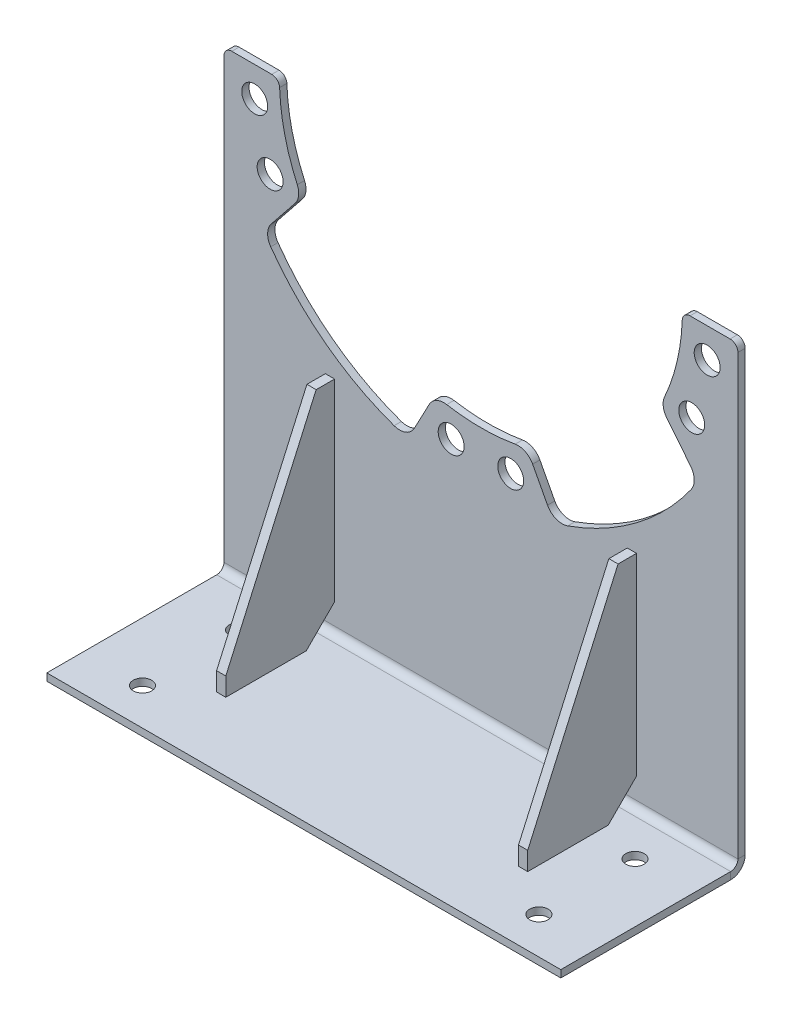
from build123d import *

# Parameters (mm, degrees)
SKETCH1_R                    = 355.6
BOSS_EXTRUDE1_DEPTH          = 60.325
SKETCH2_R                    = 17.4625
BOLTHOLE_DEPTH               = 507.499581071
BOLTHOLEPATTERN_COUNT        = 24
SKETCH5_OUTSIDE_W            = 914.72
SKETCH5_OUTSIDE_H            = 914.72
SKETCH5_OUTSIDE_R            = 266.7
RAISED_FACE_DEPTH            = 1.5875
FILLET2_R                    = 1.5875
FILLET3_R                    = 1.5875
SKETCH11_R                   = 230.886
CUT_EXTRUDE5_DEPTH           = 507.499581211
SKETCH12_R                   = 17.867836571
BOSS_EXTRUDE2_DEPTH          = 5.08
CONVERT_SOLID1_OUTLINE_R     = 355.6
CONVERT_SOLID1_OUTLINE_R_2   = 17.4625
CONVERT_SOLID1_OUTLINE_R_3   = 230.886
CONVERT_SOLID1_DEPTH         = 55.405
CONVERT_SOLID1_START         = 55.405
CONVERT_SOLID1_2_OUTLINE_R   = 17.4625
CONVERT_SOLID1_2_OUTLINE_R_2 = 230.886
CONVERT_SOLID1_2_OUTLINE_R_3 = 17.867836571
CONVERT_SOLID1_2_DEPTH       = 4.92
CONVERT_SOLID1_3_OUTLINE_R   = 17.867836571
CONVERT_SOLID1_3_DEPTH       = 4.92
EDGE_FLANGE1_STRIP_W         = 60
EDGE_FLANGE1_STRIP_H         = 10
EDGE_FLANGE1_STRIP_CUT_DEPTH = 708.025
EDGE_FLANGE1_DEPTH           = 708.025
SKETCH21_R                   = 12.7
CUT_EXTRUDE6_DEPTH           = 791.114741274
SKETCH22_W                   = 12.7
SKETCH22_H                   = 304.8
BOSS_EXTRUDE3_DEPTH          = 149.86
CUT_EXTRUDE12_DEPTH          = 907.614449346


# Read off the part's stored shape, not the designer's step: Convert-Solid1
# Sheet-metal steps are written as plain solids
with BuildPart() as part:
    # Sketch1 → Boss-Extrude1 (new body)
    with BuildSketch(Plane.XY):
        with Locations(Location((0, 0, 0), (0, 0, 180))):
            Circle(SKETCH1_R)
    extrude(amount=BOSS_EXTRUDE1_DEPTH)

    # Sketch2 → BoltHole (cut, through all)
    with BuildSketch(Plane.XY):
        with Locations(Location((41.02764537, 311.635906051, 0), (0, 0, 180))):
            Circle(SKETCH2_R)
    bolthole = extrude(amount=BOLTHOLE_DEPTH, mode=Mode.SUBTRACT)

    # BoltHolePattern: BoltHole ×24 about axis
    boltholepattern_axis = Axis((0, 0, 0), (0, 0, 1))
    for i in range(1, BOLTHOLEPATTERN_COUNT):
        add(bolthole.rotate(boltholepattern_axis, i * 360 / BOLTHOLEPATTERN_COUNT), mode=Mode.SUBTRACT)

    # Sketch5 outside → Raised Face (cut)
    with BuildSketch(Plane(origin=(0, 0, 0), x_dir=(-1, 0, 0), z_dir=(0, 0, -1))):
        Rectangle(SKETCH5_OUTSIDE_W, SKETCH5_OUTSIDE_H)
        Circle(SKETCH5_OUTSIDE_R, mode=Mode.SUBTRACT)
    extrude(amount=-RAISED_FACE_DEPTH, mode=Mode.SUBTRACT)

    # Fillet2
    fillet2_edges = [part.edges().sort_by_distance(p)[0] for p in [
        (355.6, 0, 1.5875),
        (355.6, 0, 60.325),
    ]]
    fillet(fillet2_edges, radius=FILLET2_R)

    # Fillet3
    fillet3_edges = [part.edges().sort_by_distance(p)[0] for p in [
        (266.7, 0, 1.5875),
    ]]
    fillet(fillet3_edges, radius=FILLET3_R - 0.0001)  # a hair under: the kernel refuses the full size

    # Sketch11 → Cut-Extrude5 (cut, through all)
    with BuildSketch(Plane.XY):
        with Locations(Location((0, 0, 0), (0, 0, 180))):
            Circle(SKETCH11_R)
    extrude(amount=CUT_EXTRUDE5_DEPTH, mode=Mode.SUBTRACT)

    # Sketch12 → Boss-Extrude2 (add)
    with BuildSketch(Plane.XY.offset(60.325)):
        with BuildLine():
            Line((-343.2175, 0), (-288.130046772, 0))
            ThreePointArc((-288.130046772, 0), (-280.641083905, -3.020203528), (-277.342615169, -10.390841095))
            ThreePointArc((-277.342615169, -10.390841095), (-270.190767513, -63.433783731), (-252.99027113, -114.117564297))
            ThreePointArc((-252.99027113, -114.117564297), (-251.148770275, -126.38308213), (-255.983573502, -137.804935346))
            Line((-255.983573502, -137.804935346), (-288.819243573, -178.81520867))
            ThreePointArc((-288.819243573, -178.81520867), (-293.825450252, -192.463019981), (-289.590973462, -206.369639456))
            ThreePointArc((-289.590973462, -206.369639456), (-214.456918936, -283.653996835), (-119.619161223, -334.877016632))
            ThreePointArc((-119.619161223, -334.877016632), (-103.646930374, -334.656038137), (-91.71877708, -324.031531146))
            Line((-91.71877708, -324.031531146), (-71.270266052, -285.343663587))
            ThreePointArc((-71.270266052, -285.343663587), (-61.144446621, -275.510694804), (-47.174081625, -273.498632154))
            ThreePointArc((-47.174081625, -273.498632154), (0, -277.537197088), (47.174081625, -273.498632154))
            ThreePointArc((47.174081625, -273.498632154), (61.144446621, -275.510694804), (71.270266052, -285.343663587))
            Line((71.270266052, -285.343663587), (91.71877708, -324.031531146))
            ThreePointArc((91.71877708, -324.031531146), (103.646930374, -334.656038137), (119.619161223, -334.877016632))
            ThreePointArc((119.619161223, -334.877016632), (214.456918936, -283.653996835), (289.590973462, -206.369639456))
            ThreePointArc((289.590973462, -206.369639456), (293.825450252, -192.463019981), (288.819243573, -178.81520867))
            Line((288.819243573, -178.81520867), (255.983573502, -137.804935346))
            ThreePointArc((255.983573502, -137.804935346), (251.148770275, -126.38308213), (252.99027113, -114.117564297))
            ThreePointArc((252.99027113, -114.117564297), (270.190767513, -63.433783731), (277.342615169, -10.390841095))
            ThreePointArc((277.342615169, -10.390841095), (280.641083905, -3.020203528), (288.130046772, 0))
            Line((288.130046772, 0), (343.2175, 0))
            ThreePointArc((343.2175, 0), (350.850717703, -3.161782297), (354.0125, -10.795))
            Line((354.0125, -10.795), (354.0125, -635))
            Line((354.0125, -635), (-354.0125, -635))
            Line((-354.0125, -635), (-354.0125, -10.795))
            ThreePointArc((-354.0125, -10.795), (-350.850717703, -3.161782297), (-343.2175, 0))
        make_face()
        with Locations((-311.635906051, -41.02764537)):
            Circle(SKETCH12_R, mode=Mode.SUBTRACT)
        with Locations((-290.398434057, -120.286969878)):
            Circle(SKETCH12_R, mode=Mode.SUBTRACT)
        with Locations((-41.02764537, -311.635906051)):
            Circle(SKETCH12_R, mode=Mode.SUBTRACT)
        with Locations(Location((41.02764537, -311.635906051, 0), (0, 0, 180))):
            Circle(SKETCH12_R, mode=Mode.SUBTRACT)
        with Locations(Location((290.398434057, -120.286969878, 0), (0, 0, 180))):
            Circle(SKETCH12_R, mode=Mode.SUBTRACT)
        with Locations(Location((311.635906051, -41.02764537, 0), (0, 0, 180))):
            Circle(SKETCH12_R, mode=Mode.SUBTRACT)
    extrude(amount=BOSS_EXTRUDE2_DEPTH)

    # Convert-Solid1 outline → Convert-Solid1 (cut)
    with BuildSketch(Plane.XY):
        Circle(CONVERT_SOLID1_OUTLINE_R)
        with Locations((-41.02764537, 311.635906051)):
            Circle(CONVERT_SOLID1_OUTLINE_R_2, mode=Mode.SUBTRACT)
        Circle(CONVERT_SOLID1_OUTLINE_R_3, mode=Mode.SUBTRACT)
        with Locations((311.635906051, 41.02764537)):
            Circle(CONVERT_SOLID1_OUTLINE_R_2, mode=Mode.SUBTRACT)
        with Locations((41.02764537, 311.635906051)):
            Circle(CONVERT_SOLID1_OUTLINE_R_2, mode=Mode.SUBTRACT)
        with Locations((120.286969878, 290.398434057)):
            Circle(CONVERT_SOLID1_OUTLINE_R_2, mode=Mode.SUBTRACT)
        with Locations((249.370788687, 191.348936173)):
            Circle(CONVERT_SOLID1_OUTLINE_R_2, mode=Mode.SUBTRACT)
        with Locations((290.398434057, 120.286969878)):
            Circle(CONVERT_SOLID1_OUTLINE_R_2, mode=Mode.SUBTRACT)
        with Locations((191.348936173, 249.370788687)):
            Circle(CONVERT_SOLID1_OUTLINE_R_2, mode=Mode.SUBTRACT)
        with Locations((-191.348936173, -249.370788687)):
            Circle(CONVERT_SOLID1_OUTLINE_R_2, mode=Mode.SUBTRACT)
        with Locations((-249.370788687, -191.348936173)):
            Circle(CONVERT_SOLID1_OUTLINE_R_2, mode=Mode.SUBTRACT)
        with Locations((-120.286969878, -290.398434057)):
            Circle(CONVERT_SOLID1_OUTLINE_R_2, mode=Mode.SUBTRACT)
        with Locations((120.286969878, -290.398434057)):
            Circle(CONVERT_SOLID1_OUTLINE_R_2, mode=Mode.SUBTRACT)
        with Locations((191.348936173, -249.370788687)):
            Circle(CONVERT_SOLID1_OUTLINE_R_2, mode=Mode.SUBTRACT)
        with Locations((249.370788687, -191.348936173)):
            Circle(CONVERT_SOLID1_OUTLINE_R_2, mode=Mode.SUBTRACT)
        with Locations((-311.635906051, 41.02764537)):
            Circle(CONVERT_SOLID1_OUTLINE_R_2, mode=Mode.SUBTRACT)
        with Locations((-290.398434057, 120.286969878)):
            Circle(CONVERT_SOLID1_OUTLINE_R_2, mode=Mode.SUBTRACT)
        with Locations((-249.370788687, 191.348936173)):
            Circle(CONVERT_SOLID1_OUTLINE_R_2, mode=Mode.SUBTRACT)
        with Locations((-191.348936173, 249.370788687)):
            Circle(CONVERT_SOLID1_OUTLINE_R_2, mode=Mode.SUBTRACT)
        with Locations((-120.286969878, 290.398434057)):
            Circle(CONVERT_SOLID1_OUTLINE_R_2, mode=Mode.SUBTRACT)
        with Locations((290.398434057, -120.286969878)):
            Circle(CONVERT_SOLID1_OUTLINE_R_2, mode=Mode.SUBTRACT)
        with Locations((311.635906051, -41.02764537)):
            Circle(CONVERT_SOLID1_OUTLINE_R_2, mode=Mode.SUBTRACT)
        with Locations((41.02764537, -311.635906051)):
            Circle(CONVERT_SOLID1_OUTLINE_R_2, mode=Mode.SUBTRACT)
        with Locations((-41.02764537, -311.635906051)):
            Circle(CONVERT_SOLID1_OUTLINE_R_2, mode=Mode.SUBTRACT)
        with Locations((-290.398434057, -120.286969878)):
            Circle(CONVERT_SOLID1_OUTLINE_R_2, mode=Mode.SUBTRACT)
        with Locations((-311.635906051, -41.02764537)):
            Circle(CONVERT_SOLID1_OUTLINE_R_2, mode=Mode.SUBTRACT)
    extrude(amount=CONVERT_SOLID1_DEPTH, mode=Mode.SUBTRACT)

    # Convert-Solid1 2 outline → Convert-Solid1 2 (cut)
    # profile 1 of 7: a face of its own
    with BuildSketch(Plane.XY.offset(CONVERT_SOLID1_START)):
        with BuildLine():
            Line((288.130046772, 0), (343.2175, 0))
            ThreePointArc((343.2175, 0), (350.850717703, -3.161782297), (354.0125, -10.795))
            Line((354.0125, -10.795), (354.0125, -33.563519538))
            ThreePointArc((354.0125, -33.563519538), (0, 355.6), (-354.0125, -33.563519538))
            Line((-354.0125, -33.563519538), (-354.0125, -10.795))
            ThreePointArc((-354.0125, -10.795), (-350.850717703, -3.161782297), (-343.2175, 0))
            Line((-343.2175, 0), (-288.130046772, 0))
            ThreePointArc((-288.130046772, 0), (-280.641083906, -3.020203527), (-277.342615169, -10.390841095))
            ThreePointArc((-277.342615169, -10.390841095), (-270.190767513, -63.433783731), (-252.99027113, -114.117564297))
            ThreePointArc((-252.99027113, -114.117564297), (-251.148770275, -126.38308213), (-255.983573502, -137.804935346))
            Line((-255.983573502, -137.804935346), (-288.819243573, -178.81520867))
            ThreePointArc((-288.819243573, -178.81520867), (-293.825450252, -192.463019981), (-289.590973462, -206.369639456))
            ThreePointArc((-289.590973462, -206.369639456), (-214.456918936, -283.653996835), (-119.619161223, -334.877016632))
            ThreePointArc((-119.619161223, -334.877016632), (-103.646930374, -334.656038137), (-91.71877708, -324.031531146))
            Line((-91.71877708, -324.031531146), (-71.270266052, -285.343663587))
            ThreePointArc((-71.270266052, -285.343663587), (-61.144446621, -275.510694804), (-47.174081625, -273.498632154))
            ThreePointArc((-47.174081625, -273.498632154), (0, -277.537197088), (47.174081625, -273.498632154))
            ThreePointArc((47.174081625, -273.498632154), (61.144446621, -275.510694804), (71.270266052, -285.343663587))
            Line((71.270266052, -285.343663587), (91.71877708, -324.031531146))
            ThreePointArc((91.71877708, -324.031531146), (103.646930374, -334.656038137), (119.619161223, -334.877016632))
            ThreePointArc((119.619161223, -334.877016632), (214.456918936, -283.653996835), (289.590973462, -206.369639456))
            ThreePointArc((289.590973462, -206.369639456), (293.825450252, -192.463019981), (288.819243573, -178.81520867))
            Line((288.819243573, -178.81520867), (255.983573502, -137.804935346))
            ThreePointArc((255.983573502, -137.804935346), (251.148770275, -126.38308213), (252.99027113, -114.117564297))
            ThreePointArc((252.99027113, -114.117564297), (270.190767513, -63.433783731), (277.342615169, -10.390841095))
            ThreePointArc((277.342615169, -10.390841095), (280.641083906, -3.020203527), (288.130046772, 0))
        make_face()
        with Locations((-191.348936173, -249.370788687)):
            Circle(CONVERT_SOLID1_2_OUTLINE_R, mode=Mode.SUBTRACT)
        with Locations((-249.370788687, -191.348936173)):
            Circle(CONVERT_SOLID1_2_OUTLINE_R, mode=Mode.SUBTRACT)
        with Locations((-120.286969878, -290.398434057)):
            Circle(CONVERT_SOLID1_2_OUTLINE_R, mode=Mode.SUBTRACT)
        with Locations((120.286969878, -290.398434057)):
            Circle(CONVERT_SOLID1_2_OUTLINE_R, mode=Mode.SUBTRACT)
        with Locations((191.348936173, -249.370788687)):
            Circle(CONVERT_SOLID1_2_OUTLINE_R, mode=Mode.SUBTRACT)
        with Locations((249.370788687, -191.348936173)):
            Circle(CONVERT_SOLID1_2_OUTLINE_R, mode=Mode.SUBTRACT)
        with Locations((-311.635906051, 41.02764537)):
            Circle(CONVERT_SOLID1_2_OUTLINE_R, mode=Mode.SUBTRACT)
        with Locations((-290.398434057, 120.286969878)):
            Circle(CONVERT_SOLID1_2_OUTLINE_R, mode=Mode.SUBTRACT)
        with Locations((-249.370788687, 191.348936173)):
            Circle(CONVERT_SOLID1_2_OUTLINE_R, mode=Mode.SUBTRACT)
        with Locations((-191.348936173, 249.370788687)):
            Circle(CONVERT_SOLID1_2_OUTLINE_R, mode=Mode.SUBTRACT)
        with Locations((-120.286969878, 290.398434057)):
            Circle(CONVERT_SOLID1_2_OUTLINE_R, mode=Mode.SUBTRACT)
        with Locations((-41.02764537, 311.635906051)):
            Circle(CONVERT_SOLID1_2_OUTLINE_R, mode=Mode.SUBTRACT)
        Circle(CONVERT_SOLID1_2_OUTLINE_R_2, mode=Mode.SUBTRACT)
        with Locations((311.635906051, 41.02764537)):
            Circle(CONVERT_SOLID1_2_OUTLINE_R, mode=Mode.SUBTRACT)
        with Locations((41.02764537, 311.635906051)):
            Circle(CONVERT_SOLID1_2_OUTLINE_R, mode=Mode.SUBTRACT)
        with Locations((120.286969878, 290.398434057)):
            Circle(CONVERT_SOLID1_2_OUTLINE_R, mode=Mode.SUBTRACT)
        with Locations((249.370788687, 191.348936173)):
            Circle(CONVERT_SOLID1_2_OUTLINE_R, mode=Mode.SUBTRACT)
        with Locations((290.398434057, 120.286969878)):
            Circle(CONVERT_SOLID1_2_OUTLINE_R, mode=Mode.SUBTRACT)
        with Locations((191.348936173, 249.370788687)):
            Circle(CONVERT_SOLID1_2_OUTLINE_R, mode=Mode.SUBTRACT)
    # profile 2 of 7: a face of its own
    with BuildSketch(Plane.XY.offset(CONVERT_SOLID1_START)):
        with Locations((290.398434057, -120.286969878)):
            Circle(CONVERT_SOLID1_2_OUTLINE_R_3)
        with Locations((290.398434057, -120.286969878)):
            Circle(CONVERT_SOLID1_2_OUTLINE_R, mode=Mode.SUBTRACT)
    # profile 3 of 7: a face of its own
    with BuildSketch(Plane.XY.offset(CONVERT_SOLID1_START)):
        with Locations((-41.02764537, -311.635906051)):
            Circle(CONVERT_SOLID1_2_OUTLINE_R_3)
        with Locations((-41.02764537, -311.635906051)):
            Circle(CONVERT_SOLID1_2_OUTLINE_R, mode=Mode.SUBTRACT)
    # profile 4 of 7: a face of its own
    with BuildSketch(Plane.XY.offset(CONVERT_SOLID1_START)):
        with Locations((-311.635906051, -41.02764537)):
            Circle(CONVERT_SOLID1_2_OUTLINE_R_3)
        with Locations((-311.635906051, -41.02764537)):
            Circle(CONVERT_SOLID1_2_OUTLINE_R, mode=Mode.SUBTRACT)
    # profile 5 of 7: a face of its own
    with BuildSketch(Plane.XY.offset(CONVERT_SOLID1_START)):
        with Locations((-290.398434057, -120.286969878)):
            Circle(CONVERT_SOLID1_2_OUTLINE_R_3)
        with Locations((-290.398434057, -120.286969878)):
            Circle(CONVERT_SOLID1_2_OUTLINE_R, mode=Mode.SUBTRACT)
    # profile 6 of 7: a face of its own
    with BuildSketch(Plane.XY.offset(CONVERT_SOLID1_START)):
        with Locations((41.02764537, -311.635906051)):
            Circle(CONVERT_SOLID1_2_OUTLINE_R_3)
        with Locations((41.02764537, -311.635906051)):
            Circle(CONVERT_SOLID1_2_OUTLINE_R, mode=Mode.SUBTRACT)
    # profile 7 of 7: a face of its own
    with BuildSketch(Plane.XY.offset(CONVERT_SOLID1_START)):
        with Locations((311.635906051, -41.02764537)):
            Circle(CONVERT_SOLID1_2_OUTLINE_R_3)
        with Locations((311.635906051, -41.02764537)):
            Circle(CONVERT_SOLID1_2_OUTLINE_R, mode=Mode.SUBTRACT)
    extrude(amount=CONVERT_SOLID1_2_DEPTH, mode=Mode.SUBTRACT)

    # Convert-Solid1 3 outline → Convert-Solid1 3 (add)
    with BuildSketch(Plane.XY.offset(CONVERT_SOLID1_START)):
        with BuildLine():
            ThreePointArc((354.0125, -10.795), (350.850717703, -3.161782297), (343.2175, 0))
            Line((343.2175, 0), (288.130046772, 0))
            ThreePointArc((288.130046772, 0), (280.641083906, -3.020203527), (277.342615169, -10.390841095))
            ThreePointArc((277.342615169, -10.390841095), (270.190767513, -63.433783731), (252.99027113, -114.117564297))
            ThreePointArc((252.99027113, -114.117564297), (251.148770275, -126.38308213), (255.983573502, -137.804935346))
            Line((255.983573502, -137.804935346), (288.819243573, -178.81520867))
            ThreePointArc((288.819243573, -178.81520867), (293.825450252, -192.463019981), (289.590973462, -206.369639456))
            ThreePointArc((289.590973462, -206.369639456), (214.456918936, -283.653996835), (119.619161223, -334.877016632))
            ThreePointArc((119.619161223, -334.877016632), (103.646930374, -334.656038137), (91.71877708, -324.031531146))
            Line((91.71877708, -324.031531146), (71.270266052, -285.343663587))
            ThreePointArc((71.270266052, -285.343663587), (61.144446621, -275.510694804), (47.174081625, -273.498632154))
            ThreePointArc((47.174081625, -273.498632154), (0, -277.537197088), (-47.174081625, -273.498632154))
            ThreePointArc((-47.174081625, -273.498632154), (-61.144446621, -275.510694804), (-71.270266052, -285.343663587))
            Line((-71.270266052, -285.343663587), (-91.71877708, -324.031531146))
            ThreePointArc((-91.71877708, -324.031531146), (-103.646930374, -334.656038137), (-119.619161223, -334.877016632))
            ThreePointArc((-119.619161223, -334.877016632), (-214.456918936, -283.653996835), (-289.590973462, -206.369639456))
            ThreePointArc((-289.590973462, -206.369639456), (-293.825450252, -192.463019981), (-288.819243573, -178.81520867))
            Line((-288.819243573, -178.81520867), (-255.983573502, -137.804935346))
            ThreePointArc((-255.983573502, -137.804935346), (-251.148770275, -126.38308213), (-252.99027113, -114.117564297))
            ThreePointArc((-252.99027113, -114.117564297), (-270.190767513, -63.433783731), (-277.342615169, -10.390841095))
            ThreePointArc((-277.342615169, -10.390841095), (-280.641083906, -3.020203527), (-288.130046772, 0))
            Line((-288.130046772, 0), (-343.2175, 0))
            ThreePointArc((-343.2175, 0), (-350.850717703, -3.161782297), (-354.0125, -10.795))
            Line((-354.0125, -10.795), (-354.0125, -635))
            Line((-354.0125, -635), (354.0125, -635))
            Line((354.0125, -635), (354.0125, -10.795))
        make_face()
        with Locations((290.398434057, -120.286969878)):
            Circle(CONVERT_SOLID1_3_OUTLINE_R, mode=Mode.SUBTRACT)
        with Locations((311.635906051, -41.02764537)):
            Circle(CONVERT_SOLID1_3_OUTLINE_R, mode=Mode.SUBTRACT)
        with Locations((-311.635906051, -41.02764537)):
            Circle(CONVERT_SOLID1_3_OUTLINE_R, mode=Mode.SUBTRACT)
        with Locations((-290.398434057, -120.286969878)):
            Circle(CONVERT_SOLID1_3_OUTLINE_R, mode=Mode.SUBTRACT)
        with Locations((41.02764537, -311.635906051)):
            Circle(CONVERT_SOLID1_3_OUTLINE_R, mode=Mode.SUBTRACT)
        with Locations((-41.02764537, -311.635906051)):
            Circle(CONVERT_SOLID1_3_OUTLINE_R, mode=Mode.SUBTRACT)
    extrude(amount=CONVERT_SOLID1_3_DEPTH)

    # Edge-Flange1 strip (across the edge) → Edge-Flange1 strip cut (cut)
    with BuildSketch(Plane(origin=(-354.0125, -635, 65.405), x_dir=(0, 1, 0), z_dir=(1, 0, 0))):
        with Locations((-10, -5)):
            Rectangle(EDGE_FLANGE1_STRIP_W, EDGE_FLANGE1_STRIP_H)
    extrude(amount=EDGE_FLANGE1_STRIP_CUT_DEPTH, mode=Mode.SUBTRACT)

    # Edge-Flange1 section (across the edge) → Edge-Flange1 (add)
    with BuildSketch(Plane(origin=(-354.0125, -635, 65.405), x_dir=(0, 1, 0), z_dir=(1, 0, 0))):
        with BuildLine():
            Line((0, 10), (0, 244))
            Line((0, 244), (10, 244))
            Line((10, 244), (10, 10))
            ThreePointArc((10, 10), (12.928932188, 2.928932188), (20, 0))
            Line((20, 0), (20, -10))
            ThreePointArc((20, -10), (5.857864376, -4.142135624), (0, 10))
        make_face()
    extrude(amount=EDGE_FLANGE1_DEPTH)

    # Sketch21 → Cut-Extrude6 (cut, through all)
    with BuildSketch(Plane.XZ.offset(635)):
        with Locations(Location((273.05, 258.605, 0), (0, 0, 270))):
            Circle(SKETCH21_R)
        with Locations(Location((273.05, 126.205, 0), (0, 0, 90))):
            Circle(SKETCH21_R)
        with Locations(Location((-273.05, 126.205, 0), (0, 0, 270))):
            Circle(SKETCH21_R)
        with Locations(Location((-273.05, 258.605, 0), (0, 0, 90))):
            Circle(SKETCH21_R)
    extrude(amount=-CUT_EXTRUDE6_DEPTH, mode=Mode.SUBTRACT)

    # Sketch22 → Boss-Extrude3 (add)
    with BuildSketch(Plane.XY.offset(65.405)):
        with Locations((-207.9625, -472.6)):
            Rectangle(SKETCH22_W, SKETCH22_H)
        with Locations((207.9625, -472.6)):
            Rectangle(SKETCH22_W, SKETCH22_H)
    extrude(amount=BOSS_EXTRUDE3_DEPTH)

    # Sketch23 → Cut-Extrude12 (cut, through all)
    with BuildSketch(Plane.ZY.offset(214.3125)):
        with BuildLine():
            Line((65.405, -585.99101891), (104.41398109, -625))
            Line((104.41398109, -625), (75.405, -625))
            ThreePointArc((75.405, -625), (68.333932188, -622.071067812), (65.405, -615))
            Line((65.405, -615), (65.405, -585.99101891))
        make_face()
        Polygon((90.805, -320.2), (215.265, -599.6), (215.265, -320.2), align=None)
    extrude(amount=-CUT_EXTRUDE12_DEPTH, mode=Mode.SUBTRACT)


solid = part.part
